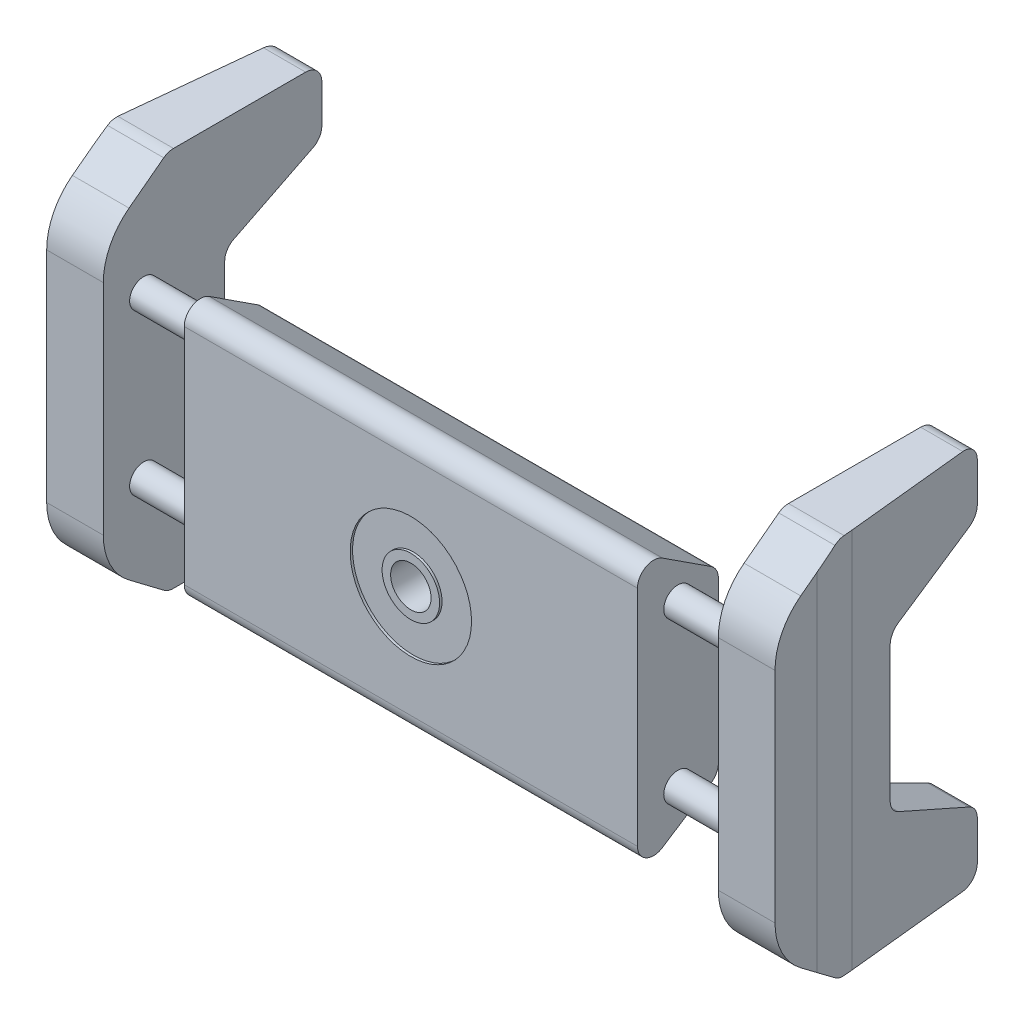
from build123d import *

# Parameters (mm, degrees)
BOSS_EXTRUDE1_DEPTH     = 56
SKETCH2_R               = 1.75
BOSS_EXTRUDE2_DEPTH     = 10
BOSS_EXTRUDE3_DEPTH     = 7
CUT_EXTRUDE1_DEPTH      = 13
CUT_EXTRUDE1_DEPTH_BACK = 44
FILLET1_R               = 45
CUT_EXTRUDE2_DEPTH      = 44
CUT_EXTRUDE2_DEPTH_BACK = 44
SKETCH5_R               = 2.5
SKETCH6_R               = 5
CUT_EXTRUDE3_DEPTH      = 1
CUT_EXTRUDE3_DRAFT      = -66
SKETCH7_R               = 7.5
SKETCH7_R_2             = 3.552716841
CUT_EXTRUDE4_DEPTH      = 0.3


with BuildPart() as part:
    # Sketch1 → Boss-Extrude1 (new body)
    with BuildSketch(Plane(origin=(0, 0, 0), x_dir=(0, 0, -1), z_dir=(1, 0, 0))):
        with BuildLine():
            Line((3.089976701, -2.008484856), (9.089976701, -5.908484856))
            ThreePointArc((9.089976701, -5.908484856), (9.757832956, -6.631420675), (10, -7.585372088))
            Line((10, -7.585372088), (10, -27.414627912))
            ThreePointArc((10, -27.414627912), (9.757832956, -28.368579325), (9.089976701, -29.091515144))
            Line((9.089976701, -29.091515144), (3.089976701, -32.991515144))
            ThreePointArc((3.089976701, -32.991515144), (1.046048587, -33.072460868), (0, -31.314627912))
            Line((0, -31.314627912), (0, -3.685372088))
            ThreePointArc((0, -3.685372088), (1.046048587, -1.927539132), (3.089976701, -2.008484856))
        make_face()
    extrude(amount=BOSS_EXTRUDE1_DEPTH)

    # Sketch2 → Boss-Extrude2 (add)
    with BuildSketch(Plane(origin=(56, 0, 0), x_dir=(0, 0, -1), z_dir=(1, 0, 0))):
        with Locations((5, -7.585372088)):
            Circle(SKETCH2_R)
        with Locations(Location((5, -27.414627912, 0), (0, 0, 180))):
            Circle(SKETCH2_R)
    extrude(amount=BOSS_EXTRUDE2_DEPTH)

    # Sketch3 → Boss-Extrude3 (add)
    with BuildSketch(Plane(origin=(66, 0, 0), x_dir=(0, 0, -1), z_dir=(1, 0, 0))):
        with BuildLine():
            Line((25.894427191, -32.489269358), (16.105572809, -27.594842167))
            ThreePointArc((16.105572809, -27.594842167), (15.298698383, -26.857450009), (15, -25.805987785))
            Line((15, -25.805987785), (15, -9.194012215))
            ThreePointArc((15, -9.194012215), (15.298698383, -8.142549991), (16.105572809, -7.405157833))
            Line((16.105572809, -7.405157833), (25.894427191, -2.510730642))
            ThreePointArc((25.894427191, -2.510730642), (26.701301617, -1.773338484), (27, -0.72187626))
            Line((27, -0.72187626), (27, 4.042055763))
            ThreePointArc((27, 4.042055763), (26.414213562, 5.456269325), (25, 6.042055763))
            Line((25, 6.042055763), (8.670397624, 6.042055763))
            ThreePointArc((8.670397624, 6.042055763), (8.034759221, 5.938358434), (7.465034823, 5.638019584))
            Line((7.465034823, 5.638019584), (3.178548798, 2.400621135))
            ThreePointArc((3.178548798, 2.400621135), (0.838589189, -0.417537137), (0, -3.98323415))
            Line((0, -3.98323415), (0, -31.01676585))
            ThreePointArc((0, -31.01676585), (0.838589189, -34.582462863), (3.178548798, -37.400621135))
            Line((3.178548798, -37.400621135), (7.465034823, -40.638019584))
            ThreePointArc((7.465034823, -40.638019584), (8.034759221, -40.938358434), (8.670397624, -41.042055763))
            Line((8.670397624, -41.042055763), (25, -41.042055763))
            ThreePointArc((25, -41.042055763), (26.414213562, -40.456269325), (27, -39.042055763))
            Line((27, -39.042055763), (27, -34.27812374))
            ThreePointArc((27, -34.27812374), (26.701301617, -33.226661516), (25.894427191, -32.489269358))
        make_face()
    extrude(amount=BOSS_EXTRUDE3_DEPTH)

    # Sketch4 → Cut-Extrude1 (cut, two sides: drawn at the far end of the back side and taken through both)
    with BuildSketch(Plane(origin=(0, 0, 0), x_dir=(1, 0, 0), z_dir=(0, 1, 0)).offset(-CUT_EXTRUDE1_DEPTH_BACK)):
        Polygon((73, 7.465034823), (71, 27), (73.488916827, 29.217701415), (75.731950279, 28.881788193), (75.634427086, 22.987052936), (74.610433553, 7.640140994), align=None)
    extrude(amount=CUT_EXTRUDE1_DEPTH + CUT_EXTRUDE1_DEPTH_BACK, mode=Mode.SUBTRACT)

    # Fillet1
    # the kernel refuses this fillet: 45 mm, written as the material it takes off along each edge
    with BuildSketch(Plane(origin=(73, -46.381911836, -7.465034823), x_dir=(0, 0, 1), z_dir=(0, 1, 0))) as fillet1_piece_1:
        with BuildLine():
            CenterArc((FILLET1_R * 0.0510568200202, -FILLET1_R), FILLET1_R, 90, 5.845604693)
            Line((-FILLET1_R * 0.0507913223976, -FILLET1_R * 0.00520004227682), (0, 0))
            Line((0, 0), (FILLET1_R * 0.0510568200202, 0))
        make_face()
    extrude(amount=57.763823673, mode=Mode.SUBTRACT)

    # Mirror1: part across plane


with BuildPart() as part_1:
    add(part.part)
    add(part.part.mirror(Plane(origin=(28, 0, 0), x_dir=(0, 0, 1), z_dir=(1, 0, 0))))

    # Sketch5 → Cut-Extrude2 (cut, two sides: drawn at the far end of the back side and taken through both)
    with BuildSketch(Plane.XY.offset(-CUT_EXTRUDE2_DEPTH_BACK)):
        with Locations(Location((28, -17.5, 0), (0, 0, 270))):
            Circle(SKETCH5_R)
    extrude(amount=CUT_EXTRUDE2_DEPTH + CUT_EXTRUDE2_DEPTH_BACK, mode=Mode.SUBTRACT)


with BuildPart() as cut_extrude3_tool:
    # Sketch6 → Cut-Extrude3 (with draft: the straight prism first)
    with BuildSketch(Plane(origin=(0, 0, -10), x_dir=(-1, 0, 0), z_dir=(0, 0, -1))):
        with Locations((-28, -17.5)):
            Circle(SKETCH6_R)
    extrude(amount=-CUT_EXTRUDE3_DEPTH)
    # Cut-Extrude3: the draft: its side faces are tilted about the plane it starts from
    cut_extrude3_sides = [cut_extrude3_tool.faces().sort_by_distance(p)[0] for p in [
        (33, -17.5, -9.5),
    ]]
    draft(cut_extrude3_sides, Plane(origin=(0, 0, -10), x_dir=(-1, 0, 0), z_dir=(0, 0, -1)), CUT_EXTRUDE3_DRAFT)


with BuildPart() as part_2:
    add(part_1.part)

    # Cut-Extrude3: cut by cut_extrude3_tool
    add(cut_extrude3_tool.part, mode=Mode.SUBTRACT)

    # Sketch7 → Cut-Extrude4 (cut)
    with BuildSketch(Plane.XY):
        with Locations((28, -17.5)):
            Circle(SKETCH7_R)
        with Locations((28, -17.5)):
            Circle(SKETCH7_R_2, mode=Mode.SUBTRACT)
    extrude(amount=-CUT_EXTRUDE4_DEPTH, mode=Mode.SUBTRACT)


solid = part_2.part
